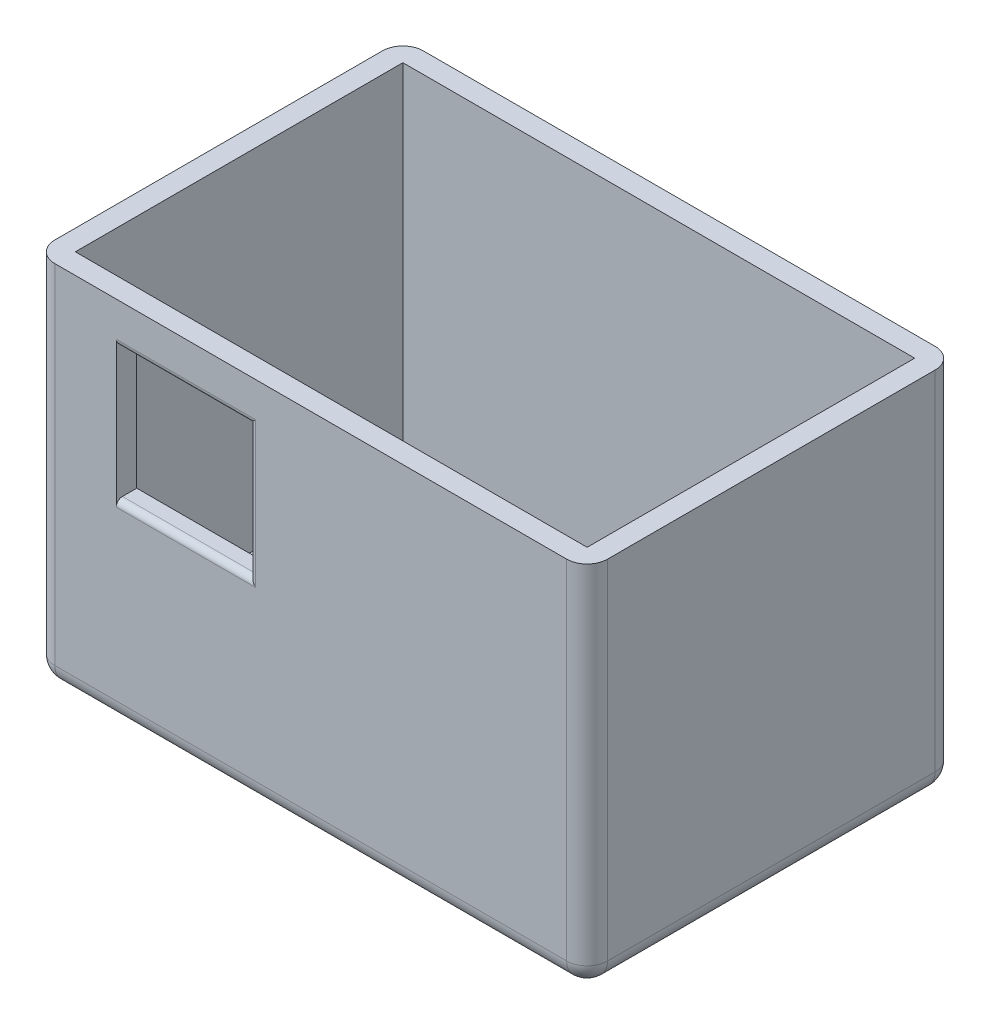
from build123d import *

# Parameters (mm, degrees)
SKETCH1_W        = 270
SKETCH1_H        = 180
EXTRUDE1_DEPTH   = 180
FILLET1_R        = 10
SHELL1_START     = -125
SHELL1_OUTLINE_W = 170
SHELL1_OUTLINE_H = 160
SHELL1_DEPTH     = 250
SKETCH2_W        = 65
SKETCH2_H        = 65
EXTRUDE2_DEPTH   = 20
FILLET2_R        = 3


# Read off the part's stored shape, not the designer's step: Shell1
with BuildPart() as part:
    # Sketch1 → Extrude1 (new body)
    with BuildSketch(Plane(origin=(0, 0, 0), x_dir=(1, 0, 0), z_dir=(0, 1, 0))):
        Rectangle(SKETCH1_W, SKETCH1_H)
    extrude(amount=EXTRUDE1_DEPTH)

    # Fillet1
    fillet1_edges = [part.edges().sort_by_distance(p)[0] for p in [
        (0, 0, 90),
        (-135, 0, 0),
        (0, 0, -90),
        (135, 0, 0),
        (135, 90, 90),
        (-135, 90, 90),
        (-135, 90, -90),
        (135, 90, -90),
    ]]
    fillet(fillet1_edges, radius=FILLET1_R)

    # Shell1 outline → Shell1 (cut)
    with BuildSketch(Plane.YZ.offset(SHELL1_START)):
        with Locations((95, 0)):
            Rectangle(SHELL1_OUTLINE_W, SHELL1_OUTLINE_H)
    extrude(amount=SHELL1_DEPTH, mode=Mode.SUBTRACT)

    # Sketch2 → Extrude2 (cut)
    with BuildSketch(Plane.XY.offset(90)):
        with Locations((-62.5, 127.5)):
            Rectangle(SKETCH2_W, SKETCH2_H)
    extrude(amount=-EXTRUDE2_DEPTH, mode=Mode.SUBTRACT)

    # Fillet2
    fillet2_edges = [part.edges().sort_by_distance(p)[0] for p in [
        (-62.5, 95, 90),
        (-30, 127.5, 90),
        (-62.5, 160, 90),
    ]]
    fillet(fillet2_edges, radius=FILLET2_R)


solid = part.part
